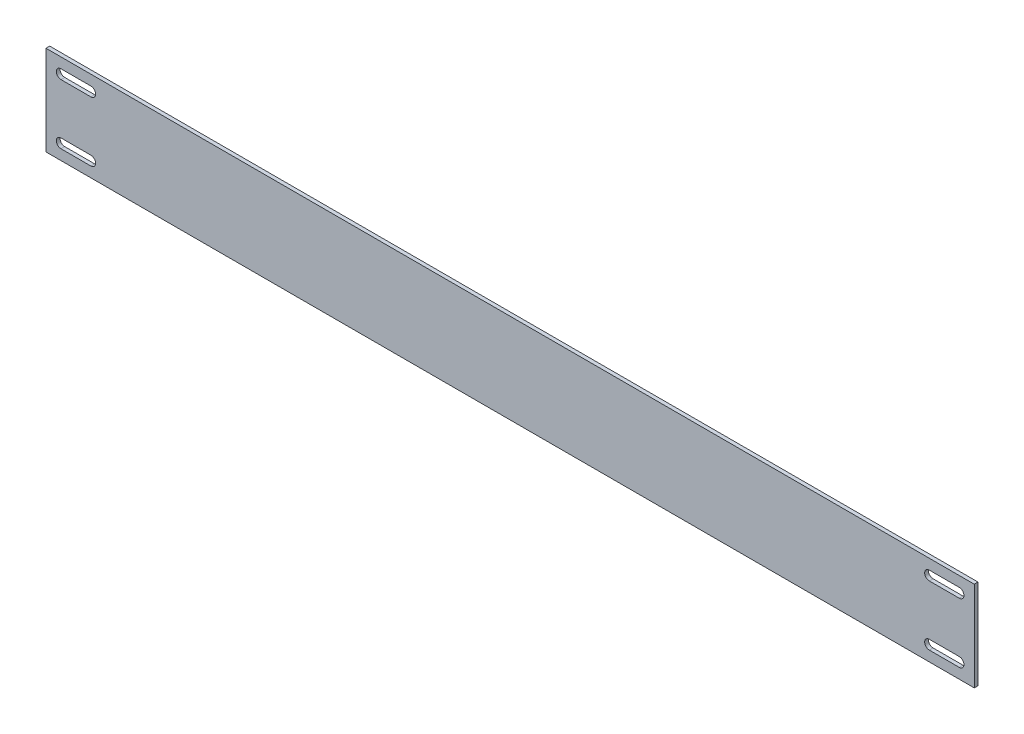
from build123d import *

# Parameters (mm, degrees)
BOSS_EXTRUDE1_DEPTH = 38.1
CUT_EXTRUDE2_DEPTH  = 396.54243787


with BuildPart() as part:
    # Sketch1 → Boss-Extrude1 (new body)
    with BuildSketch(Plane(origin=(0, 0, 0), x_dir=(1, 0, 0), z_dir=(0, 1, 0))):
        Polygon((0, 0), (393.7, 0), (393.7, 1.5875), (368.3, 1.5875), (25.4, 1.5875), (0, 1.5875), align=None)
    extrude(amount=BOSS_EXTRUDE1_DEPTH)

    # Sketch2 → Cut-Extrude2 (cut, through all)
    with BuildSketch(Plane(origin=(0, 0, -1.5875), x_dir=(-1, 0, 0), z_dir=(0, 0, -1))):
        with BuildLine():
            Line((-6.35, 33.734375), (-19.05, 33.734375))
            ThreePointArc((-19.05, 33.734375), (-21.034375, 31.75), (-19.05, 29.765625))
            Line((-19.05, 29.765625), (-6.35, 29.765625))
            ThreePointArc((-6.35, 29.765625), (-4.365625, 31.75), (-6.35, 33.734375))
        make_face()
        with BuildLine():
            ThreePointArc((-19.05, 8.334375), (-21.034375, 6.35), (-19.05, 4.365625))
            Line((-19.05, 4.365625), (-6.35, 4.365625))
            ThreePointArc((-6.35, 4.365625), (-4.365625, 6.35), (-6.35, 8.334375))
            Line((-6.35, 8.334375), (-19.05, 8.334375))
        make_face()
        with BuildLine():
            Line((-387.35, 4.365625), (-374.65, 4.365625))
            ThreePointArc((-374.65, 4.365625), (-372.665625, 6.35), (-374.65, 8.334375))
            Line((-374.65, 8.334375), (-387.35, 8.334375))
            ThreePointArc((-387.35, 8.334375), (-389.334375, 6.35), (-387.35, 4.365625))
        make_face()
        with BuildLine():
            ThreePointArc((-374.65, 29.765625), (-372.665625, 31.75), (-374.65, 33.734375))
            Line((-374.65, 33.734375), (-387.35, 33.734375))
            ThreePointArc((-387.35, 33.734375), (-389.334375, 31.75), (-387.35, 29.765625))
            Line((-387.35, 29.765625), (-374.65, 29.765625))
        make_face()
    extrude(amount=-CUT_EXTRUDE2_DEPTH, mode=Mode.SUBTRACT)


solid = part.part
